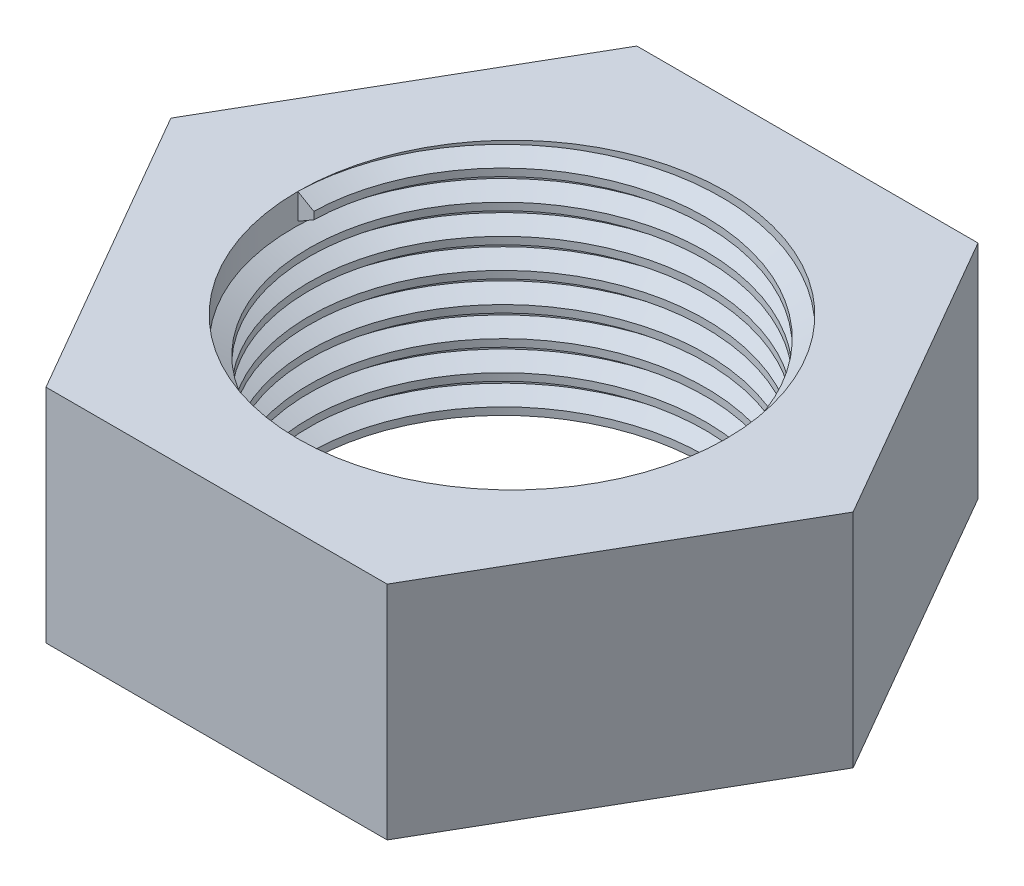
from build123d import *
from build123d.topology import SkipClean

# Parameters (mm, degrees)
BOSS_EXTRUDE1_DEPTH = 15
SKETCH3_R           = 14.5
CUT_EXTRUDE1_DEPTH  = 35.034296428
THREAD3_PITCH       = 2


with BuildPart() as part:
    # Sketch2 → Boss-Extrude1 (new body)
    with BuildSketch(Plane(origin=(0, 0, 0), x_dir=(1, 0, 0), z_dir=(0, 1, 0))):
        Polygon((23.094010768, 0), (11.547005384, 20), (-11.547005384, 20), (-23.094010768, 0), (-11.547005384, -20), (11.547005384, -20), align=None)
    extrude(amount=BOSS_EXTRUDE1_DEPTH)

    # Sketch3 → Cut-Extrude1 (cut, through all)
    with BuildSketch(Plane(origin=(0, 15, 0), x_dir=(1, 0, 0), z_dir=(0, 1, 0))):
        with Locations(Location((0, 0, 0), (0, 0, 270))):
            Circle(SKETCH3_R)
    extrude(amount=-CUT_EXTRUDE1_DEPTH, mode=Mode.SUBTRACT)

    # Thread3: the profile of Thread Profile3 profile screwed along a right-hand helix of 7.5 turns, 10 arcs to a turn; built about Z, then put on its axis
    with SkipClean():  # the faces are left unmerged after this step: merging them gives an invalid solid
        thread3_z = Axis((0, 0, 0), (0, 0, 1))
        thread3_corners = [(14.5003, 0, -0.000173205), (14.5003, 0, 1.7501732), (13.41746825, 0, 1.124999997), (13.41746825, 0, 0.624999997)]
        with BuildLine(mode=Mode.PRIVATE) as thread3_profile:
            Line(thread3_corners[0], thread3_corners[1])
            Line(thread3_corners[1], thread3_corners[2])
            Line(thread3_corners[2], thread3_corners[3])
            Line(thread3_corners[3], thread3_corners[0])
        thread3_cap = Face(thread3_profile.wire())
        thread3_turn_angles = [0, 18, 36, 54, 72, 90, 108, 126, 144, 162, 180, 198, 216, 234, 252, 270, 288, 306, 324, 342, 360]
        thread3_turn_weights = [1, 0.9510565162951535, 1, 0.9510565162951535, 1, 0.9510565162951535, 1, 0.9510565162951535, 1, 0.9510565162951535, 1, 0.9510565162951535, 1, 0.9510565162951535, 1, 0.9510565162951535, 1, 0.9510565162951535, 1, 0.9510565162951535, 1]
        thread3_turn_rails = [Edge.make_bspline([Vector(p[0], p[1], 0).rotate(thread3_z, thread3_turn_angles[k]) / thread3_turn_weights[k] + Vector(0, 0, p[2] + THREAD3_PITCH * thread3_turn_angles[k] / 360) for k in range(21)], [0, 0, 0, 1, 1, 2, 2, 3, 3, 4, 4, 5, 5, 6, 6, 7, 7, 8, 8, 9, 9, 10, 10, 10], 2, thread3_turn_weights) for p in thread3_corners]
        thread3_turn_sides = [Face.make_surface_from_curves(thread3_turn_rails[p[0]], thread3_turn_rails[p[1]]) for p in [(0, 1), (1, 2), (2, 3), (3, 0)]]
        thread3_last_angles = [2520, 2538, 2556, 2574, 2592, 2610, 2628, 2646, 2664, 2682, 2700]
        thread3_last_weights = [1, 0.9510565162951535, 1, 0.9510565162951535, 1, 0.9510565162951535, 1, 0.9510565162951535, 1, 0.9510565162951535, 1]
        thread3_last_rails = [Edge.make_bspline([Vector(p[0], p[1], 0).rotate(thread3_z, thread3_last_angles[k]) / thread3_last_weights[k] + Vector(0, 0, p[2] + THREAD3_PITCH * thread3_last_angles[k] / 360) for k in range(11)], [0, 0, 0, 1, 1, 2, 2, 3, 3, 4, 4, 5, 5, 5], 2, thread3_last_weights) for p in thread3_corners]
        thread3_last_sides = [Face.make_surface_from_curves(thread3_last_rails[p[0]], thread3_last_rails[p[1]]) for p in [(0, 1), (1, 2), (2, 3), (3, 0)]]
        thread3 = Plane(origin=(0, 15, 0), x_dir=(-1, 0, 0), z_dir=(0, -1, 0)) * Solid(Shell([*[p.moved(Location((0, 0, THREAD3_PITCH * i))) for i in range(7) for p in thread3_turn_sides], *thread3_last_sides, thread3_cap, thread3_cap.rotate(thread3_z, 2700).moved(Location((0, 0, THREAD3_PITCH * 2700 / 360)))]))
        add(thread3)


solid = part.part
